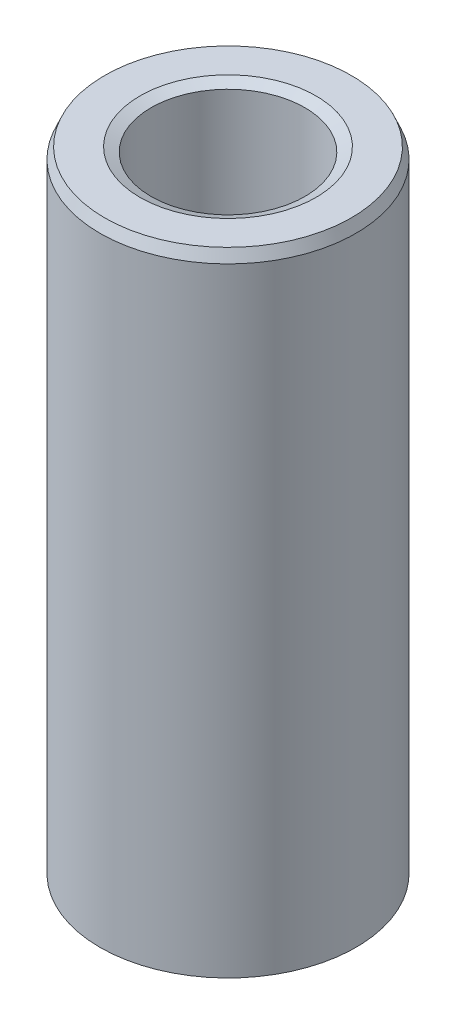
from build123d import *
from OCP.BRepFilletAPI import BRepFilletAPI_MakeChamfer

# Parameters (mm, degrees)
SKETCH1_R           = 37.5
BOSS_EXTRUDE1_DEPTH = 185.728124127
SKETCH2_R           = 22.543636389
CUT_EXTRUDE1_DEPTH  = 194.15132951
CHAMFER1_SIZE       = 3.2327686
CHAMFER1_SIZE2      = 1.373182365


with BuildPart() as part:
    # Sketch1 → Boss-Extrude1 (new body)
    with BuildSketch(Plane(origin=(0, 0, 0), x_dir=(1, 0, 0), z_dir=(0, 1, 0))):
        Circle(SKETCH1_R)
    extrude(amount=BOSS_EXTRUDE1_DEPTH)

    # Sketch2 → Cut-Extrude1 (cut, through all)
    with BuildSketch(Plane(origin=(0, 0, 0), x_dir=(1, 0, 0), z_dir=(0, 1, 0))):
        Circle(SKETCH2_R)
    extrude(amount=CUT_EXTRUDE1_DEPTH, mode=Mode.SUBTRACT)

    # Chamfer1: one chamfer whose edges measure the first distance from different faces: ONE call of the kernel's chamfer builder (chamfer() names one face for all edges)
    chamfer1_edges_1 = [part.edges().sort_by_distance(p)[0] for p in [
        (-22.543636389, 185.728124127, 0),
    ]]
    chamfer1_side_1 = [part.faces().sort_by_distance(p)[0] for p in [
        (-36.439339828, 185.728124127, 0),
    ]]
    chamfer1_edges_2 = [part.edges().sort_by_distance(p)[0] for p in [
        (-22.543636389, 0, 0),
    ]]
    chamfer1_side_2 = [part.faces().sort_by_distance(p)[0] for p in [
        (-22.543636389, 92.864062063, 0),
    ]]
    chamfer1_edges_3 = [part.edges().sort_by_distance(p)[0] for p in [
        (-37.5, 0, 0),
    ]]
    chamfer1_side_3 = [part.faces().sort_by_distance(p)[0] for p in [
        (-36.439339828, 0, 0),
    ]]
    chamfer1_edges_4 = [part.edges().sort_by_distance(p)[0] for p in [
        (-37.5, 185.728124127, 0),
    ]]
    chamfer1_side_4 = [part.faces().sort_by_distance(p)[0] for p in [
        (-37.5, 92.864062063, 0),
    ]]
    chamfer1 = BRepFilletAPI_MakeChamfer(part.part.solid().wrapped)
    for e in chamfer1_edges_1:
        chamfer1.Add(CHAMFER1_SIZE, CHAMFER1_SIZE2, e.wrapped, chamfer1_side_1[0].wrapped)  # the first distance lies on this face
    for e in chamfer1_edges_2:
        chamfer1.Add(CHAMFER1_SIZE, CHAMFER1_SIZE2, e.wrapped, chamfer1_side_2[0].wrapped)  # the first distance lies on this face
    for e in chamfer1_edges_3:
        chamfer1.Add(CHAMFER1_SIZE, CHAMFER1_SIZE2, e.wrapped, chamfer1_side_3[0].wrapped)  # the first distance lies on this face
    for e in chamfer1_edges_4:
        chamfer1.Add(CHAMFER1_SIZE, CHAMFER1_SIZE2, e.wrapped, chamfer1_side_4[0].wrapped)  # the first distance lies on this face
    add(Compound.cast(chamfer1.Shape()), mode=Mode.REPLACE)


solid = part.part
